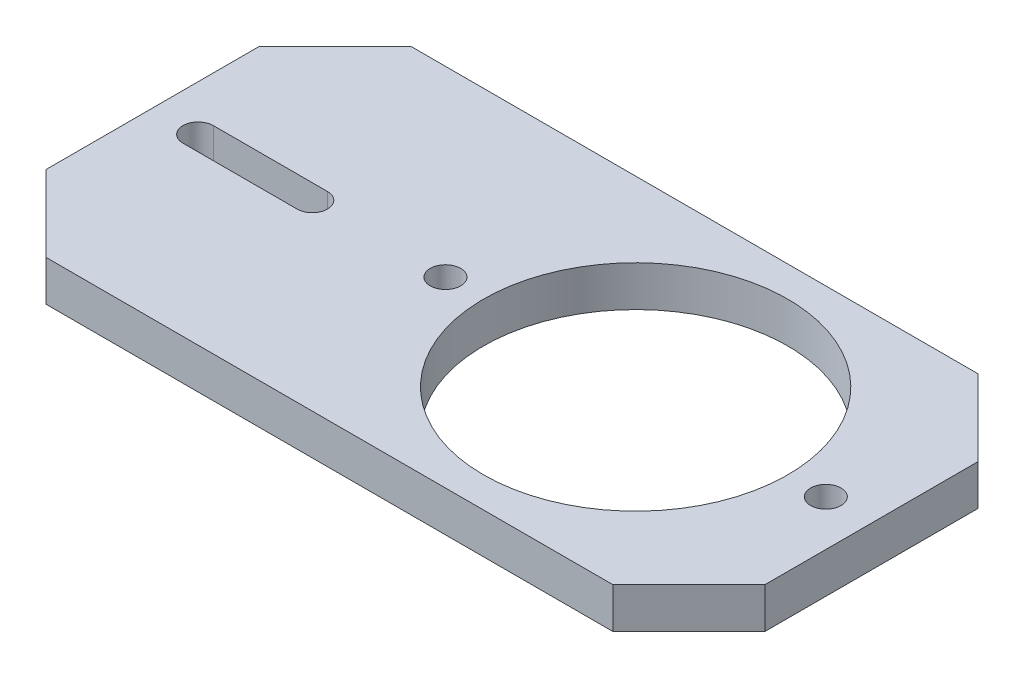
from build123d import *

# Parameters (mm, degrees)
SKETCH1_R           = 2
SKETCH1_R_2         = 20
BOSS_EXTRUDE1_DEPTH = 5.333


with BuildPart() as part:
    # Sketch1 → Boss-Extrude1 (new body)
    with BuildSketch(Plane(origin=(0, 0, 0), x_dir=(1, 0, 0), z_dir=(0, 1, 0))):
        Polygon((-63.5, 14), (-53.5, 24), (21, 24), (31, 14), (31, -14), (21, -24), (-53.5, -24), (-63.5, -14), align=None)
        with Locations((-25, 0)):
            Circle(SKETCH1_R, mode=Mode.SUBTRACT)
        with Locations((25, 0)):
            Circle(SKETCH1_R, mode=Mode.SUBTRACT)
        Circle(SKETCH1_R_2, mode=Mode.SUBTRACT)
        with BuildLine():
            Line((-57.5, 2), (-42.5, 2))
            ThreePointArc((-42.5, 2), (-40.5, 0), (-42.5, -2))
            Line((-42.5, -2), (-57.5, -2))
            ThreePointArc((-57.5, -2), (-59.5, 0), (-57.5, 2))
        make_face(mode=Mode.SUBTRACT)
    extrude(amount=-BOSS_EXTRUDE1_DEPTH)


solid = part.part
